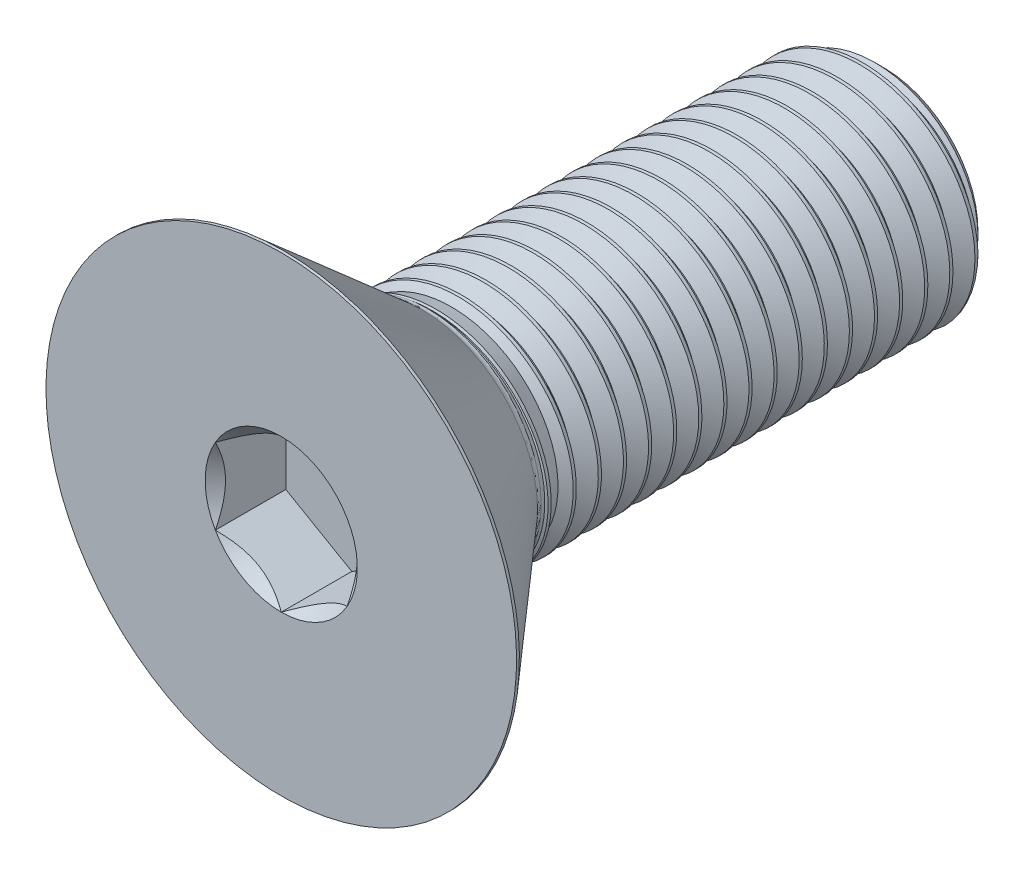
from build123d import *

# Parameters (mm, degrees)
SKETCH10_R         = 3.207902433
CUT_EXTRUDE2_DEPTH = 2.9718
CUT_EXTRUDE2_DRAFT = -45
CUT_EXTRUDE1_DEPTH = 2.9718
CUT_SWEEP1_PITCH   = 1.058333333
CUT_SWEEP1_TO      = 19.208085


with BuildPart() as part:
    # Sketch2 → Revolve1 (revolve)
    with BuildSketch(Plane(origin=(0, 0, 0), x_dir=(0, 0, -1), z_dir=(1, 0, 0))):
        with BuildLine():
            Line((-12.581128, 9.9187), (-6.7564, 4.855341198))
            ThreePointArc((-6.7564, 4.855341198), (-6.64063668, 4.78646926), (-6.508084936, 4.7625))
            Line((-6.508084936, 4.7625), (11.90625, 4.7625))
            Line((11.90625, 4.7625), (12.7, 3.96875))
            Line((12.7, 3.96875), (12.7, 0))
            Line((12.7, 0), (-12.7, 0))
            Line((-12.7, 0), (-12.7, 9.9187))
            Line((-12.7, 9.9187), (-12.581128, 9.9187))
        make_face()
    revolve(axis=Axis((0, 0, -12.7), (0, 0, 1)))


with BuildPart() as cut_extrude2_tool:
    # Sketch10 → Cut-Extrude2 (with draft: the straight prism first)
    with BuildSketch(Plane.XY.offset(12.7)):
        Circle(SKETCH10_R)
    extrude(amount=-CUT_EXTRUDE2_DEPTH)
    # Cut-Extrude2: the draft: its side faces are tilted about the plane it starts from
    cut_extrude2_sides = [cut_extrude2_tool.faces().sort_by_distance(p)[0] for p in [
        (-3.207902433, 0, 11.2141),
    ]]
    draft(cut_extrude2_sides, Plane.XY.offset(12.7), CUT_EXTRUDE2_DRAFT)


with BuildPart() as part_1:
    add(part.part)

    # Cut-Extrude2: cut by cut_extrude2_tool
    add(cut_extrude2_tool.part, mode=Mode.SUBTRACT)

    # Sketch9 → Cut-Extrude1 (cut)
    with BuildSketch(Plane.XY.offset(12.7)):
        Polygon((2.778125, -1.603951217), (2.778125, 1.603951217), (0, 3.207902433), (-2.778125, 1.603951217), (-2.778125, -1.603951217), (0, -3.207902433), align=None)
    extrude(amount=-CUT_EXTRUDE1_DEPTH, mode=Mode.SUBTRACT)


with BuildPart() as body_2:
    # Split1: the piece on the far side of the plane
    add(part_1.part)
    split(bisect_by=Plane.XY.offset(6.508084936), keep=Keep.BOTTOM)

    # Cut-Sweep1: arcs per turn and ends read off the stored shape
    # Cut-Sweep1: the profile of Sketch4 screwed along a right-hand helix through 24 turns, 8 arcs to a turn; built about Z, then put on its axis
    cut_sweep1_z = Axis((0, 0, 0), (0, 0, 1))
    cut_sweep1_corners = [(4.819783972, 0, 0.033072917), (4.819783972, 0, -0.959114583), (4.075092336, 0, -0.529166667), (4.075092336, 0, -0.396875)]
    with BuildLine(mode=Mode.PRIVATE) as cut_sweep1_profile:
        Line(cut_sweep1_corners[0], cut_sweep1_corners[1])
        Line(cut_sweep1_corners[1], cut_sweep1_corners[2])
        Line(cut_sweep1_corners[2], cut_sweep1_corners[3])
        Line(cut_sweep1_corners[3], cut_sweep1_corners[0])
    cut_sweep1_cap = Face(cut_sweep1_profile.wire())
    cut_sweep1_turn_angles = [0, 22.5, 45, 67.5, 90, 112.5, 135, 157.5, 180, 202.5, 225, 247.5, 270, 292.5, 315, 337.5, 360]
    cut_sweep1_turn_weights = [1, 0.9238795325112867, 1, 0.9238795325112867, 1, 0.9238795325112867, 1, 0.9238795325112867, 1, 0.9238795325112867, 1, 0.9238795325112867, 1, 0.9238795325112867, 1, 0.9238795325112867, 1]
    cut_sweep1_turn_rails = [Edge.make_bspline([Vector(p[0], p[1], 0).rotate(cut_sweep1_z, cut_sweep1_turn_angles[k]) / cut_sweep1_turn_weights[k] + Vector(0, 0, p[2] + CUT_SWEEP1_PITCH * cut_sweep1_turn_angles[k] / 360) for k in range(17)], [0, 0, 0, 1, 1, 2, 2, 3, 3, 4, 4, 5, 5, 6, 6, 7, 7, 8, 8, 8], 2, cut_sweep1_turn_weights) for p in cut_sweep1_corners]
    cut_sweep1_turn_sides = [Face.make_surface_from_curves(cut_sweep1_turn_rails[p[0]], cut_sweep1_turn_rails[p[1]]) for p in [(0, 1), (1, 2), (2, 3), (3, 0)]]
    cut_sweep1 = Plane(origin=(0, 0, -12.7), x_dir=(0, 1, 0), z_dir=(0, 0, 1)) * split(Solid(Shell([*[p.moved(Location((0, 0, CUT_SWEEP1_PITCH * i))) for i in range(24) for p in cut_sweep1_turn_sides], cut_sweep1_cap, cut_sweep1_cap.rotate(cut_sweep1_z, 8640).moved(Location((0, 0, CUT_SWEEP1_PITCH * 8640 / 360)))])), bisect_by=Plane.XY.offset(CUT_SWEEP1_TO), keep=Keep.BOTTOM, mode=Mode.PRIVATE)
    add(cut_sweep1, mode=Mode.SUBTRACT)


with BuildPart() as part_2:
    add(part_1.part)

    # Split1
    split(bisect_by=Plane.XY.offset(6.508084936), keep=Keep.TOP)

    add(body_2.part)  # Boss-Extrude2 merges body 2
    # Boss-Extrude2 cone 1 section (through the dimple's axis) → Boss-Extrude2 (revolve)
    with BuildSketch(Plane(origin=(0, 0, 6.508084936), x_dir=(0, -1, 0), z_dir=(1, 0, 0))):
        Polygon((0, 0), (4.7625, 0), (0, 13.08486121), align=None)
    revolve(axis=Axis((0, 0, 6.508084936), (0, 0, -1)))


solid = part_2.part
